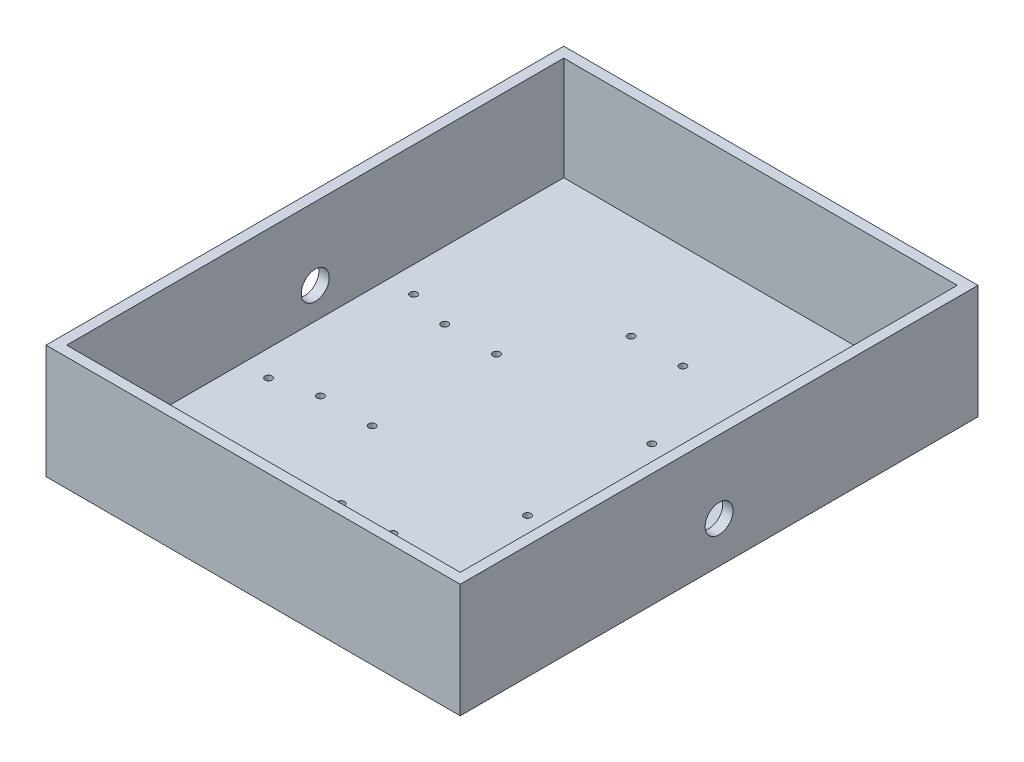
from build123d import *

# Parameters (mm, degrees)
SKETCH1_W               = 190
SKETCH1_H               = 240
BOSS_EXTRUDE2_DEPTH     = 50
SHELL3_T                = 5
CUT_EXTRUDE1_DEPTH      = 168.705098312
CUT_EXTRUDE1_DEPTH_BACK = 168.705098312
SKETCH3_R               = 1.7
CUT_EXTRUDE2_DEPTH      = 168.705098312
CUT_EXTRUDE2_DEPTH_BACK = 168.705098312
SKETCH5_R               = 6.75


with BuildPart() as part:
    # Sketch1 → Boss-Extrude2 (new body)
    with BuildSketch(Plane(origin=(0, 0, 0), x_dir=(1, 0, 0), z_dir=(0, 1, 0))):
        Rectangle(SKETCH1_W, SKETCH1_H)
    extrude(amount=BOSS_EXTRUDE2_DEPTH)

    # Shell3
    shell3_openings = [part.faces().sort_by_distance(p)[0] for p in [
        (0, 50, 0),
    ]]
    offset(amount=SHELL3_T, openings=shell3_openings, kind=Kind.INTERSECTION)

    # Sketch3 → Cut-Extrude1 (cut, two sides: drawn at the far end of the back side and taken through both)
    with BuildSketch(Plane(origin=(0, 0, 0), x_dir=(1, 0, 0), z_dir=(0, 1, 0)).offset(-CUT_EXTRUDE1_DEPTH_BACK)):
        with Locations((-12.5, 70)):
            Circle(SKETCH3_R)
        with Locations((-37.5, 30)):
            Circle(SKETCH3_R)
        with Locations((-62.5, 30)):
            Circle(SKETCH3_R)
        with Locations((-82.5, 35)):
            Circle(SKETCH3_R)
        with Locations((-12.5, -70)):
            Circle(SKETCH3_R)
        with Locations((-37.5, -30)):
            Circle(SKETCH3_R)
        with Locations((-62.5, -30)):
            Circle(SKETCH3_R)
        with Locations((-82.5, -35)):
            Circle(SKETCH3_R)
        with Locations((82.5, -35)):
            Circle(SKETCH3_R)
        with Locations((62.5, -30)):
            Circle(SKETCH3_R)
        with Locations((37.5, -30)):
            Circle(SKETCH3_R)
        with Locations((12.5, -70)):
            Circle(SKETCH3_R)
        with Locations((82.5, 35)):
            Circle(SKETCH3_R)
        with Locations((62.5, 30)):
            Circle(SKETCH3_R)
        with Locations((37.5, 30)):
            Circle(SKETCH3_R)
        with Locations((12.5, 70)):
            Circle(SKETCH3_R)
    extrude(amount=CUT_EXTRUDE1_DEPTH + CUT_EXTRUDE1_DEPTH_BACK, mode=Mode.SUBTRACT)

    # Sketch5 → Cut-Extrude2 (cut, two sides: drawn at the far end of the back side and taken through both)
    with BuildSketch(Plane(origin=(0, 0, 0), x_dir=(0, 0, -1), z_dir=(1, 0, 0)).offset(-CUT_EXTRUDE2_DEPTH_BACK)):
        with Locations((0, 15)):
            Circle(SKETCH5_R)
    extrude(amount=CUT_EXTRUDE2_DEPTH + CUT_EXTRUDE2_DEPTH_BACK, mode=Mode.SUBTRACT)


solid = part.part
